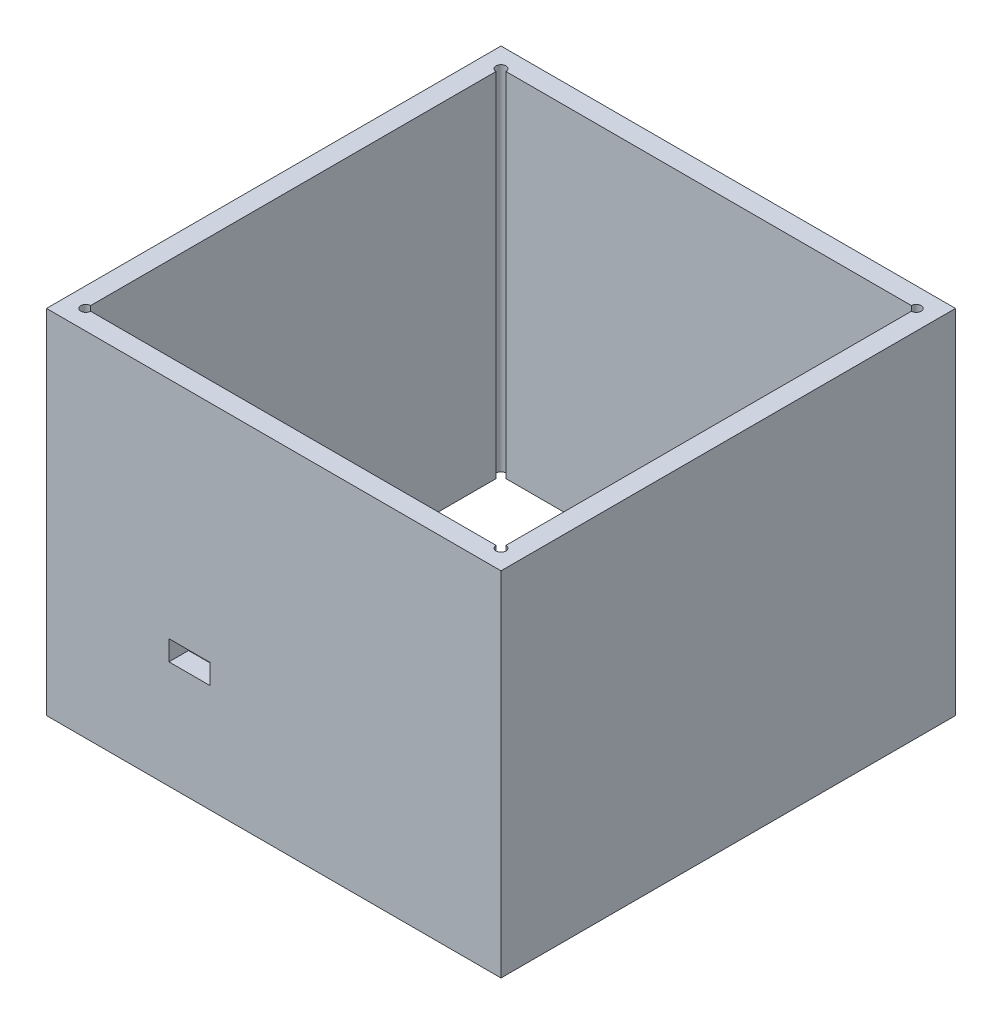
from build123d import *

# Parameters (mm, degrees)
SKETCH2_W           = 232
SKETCH2_H           = 232
SKETCH2_W_2         = 212
SKETCH2_H_2         = 212
BOSS_EXTRUDE1_DEPTH = 180
CUT_EXTRUDE1_REACH  = 317.721
SKETCH3_W           = 21
SKETCH3_H           = 10.25
CUT_EXTRUDE2_REACH  = 317.721
SKETCH4_W           = 21
SKETCH4_H           = 10.25
CUT_EXTRUDE3_REACH  = 245.541
SKETCH5_R           = 2.5


with BuildPart() as part:
    # Sketch2 → Boss-Extrude1 (new body)
    with BuildSketch(Plane(origin=(0, 0, 0), x_dir=(1, 0, 0), z_dir=(0, 1, 0))):
        Rectangle(SKETCH2_W, SKETCH2_H)
        Rectangle(SKETCH2_W_2, SKETCH2_H_2, mode=Mode.SUBTRACT)
    extrude(amount=BOSS_EXTRUDE1_DEPTH)

    # Sketch3 → Cut-Extrude1 (cut, up to next)
    with BuildSketch(Plane.XY.offset(116), mode=Mode.PRIVATE) as cut_extrude1_sk1:
        with Locations((-43, 60.125)):
            Rectangle(SKETCH3_W, SKETCH3_H)
    cut_extrude1_tool1 = extrude(cut_extrude1_sk1.sketch, amount=-CUT_EXTRUDE1_REACH, mode=Mode.PRIVATE) & part.part
    add(cut_extrude1_tool1.solids().sort_by_distance((-43, 60.125, 116))[0], mode=Mode.SUBTRACT)

    # Sketch4 → Cut-Extrude2 (cut, up to next)
    with BuildSketch(Plane(origin=(0, 0, -116), x_dir=(-1, 0, 0), z_dir=(0, 0, -1)), mode=Mode.PRIVATE) as cut_extrude2_sk1:
        with Locations((-43, 60.125)):
            Rectangle(SKETCH4_W, SKETCH4_H)
    cut_extrude2_tool1 = extrude(cut_extrude2_sk1.sketch, amount=-CUT_EXTRUDE2_REACH, mode=Mode.PRIVATE) & part.part
    add(cut_extrude2_tool1.solids().sort_by_distance((43, 60.125, -116))[0], mode=Mode.SUBTRACT)

    # Sketch5 → Cut-Extrude3 (cut, up to next)
    with BuildSketch(Plane(origin=(0, 180, 0), x_dir=(1, 0, 0), z_dir=(0, 1, 0)), mode=Mode.PRIVATE) as cut_extrude3_sk1:
        with Locations((-106, 106)):
            Circle(SKETCH5_R)
    cut_extrude3_tool1 = extrude(cut_extrude3_sk1.sketch, amount=-CUT_EXTRUDE3_REACH, mode=Mode.PRIVATE) & part.part
    # Sketch5 → Cut-Extrude3 (cut, up to next)
    with BuildSketch(Plane(origin=(0, 180, 0), x_dir=(1, 0, 0), z_dir=(0, 1, 0)), mode=Mode.PRIVATE) as cut_extrude3_sk2:
        with Locations((106, 106)):
            Circle(SKETCH5_R)
    cut_extrude3_tool2 = extrude(cut_extrude3_sk2.sketch, amount=-CUT_EXTRUDE3_REACH, mode=Mode.PRIVATE) & part.part
    # Sketch5 → Cut-Extrude3 (cut, up to next)
    with BuildSketch(Plane(origin=(0, 180, 0), x_dir=(1, 0, 0), z_dir=(0, 1, 0)), mode=Mode.PRIVATE) as cut_extrude3_sk3:
        with Locations((106, -106)):
            Circle(SKETCH5_R)
    cut_extrude3_tool3 = extrude(cut_extrude3_sk3.sketch, amount=-CUT_EXTRUDE3_REACH, mode=Mode.PRIVATE) & part.part
    # Sketch5 → Cut-Extrude3 (cut, up to next)
    with BuildSketch(Plane(origin=(0, 180, 0), x_dir=(1, 0, 0), z_dir=(0, 1, 0)), mode=Mode.PRIVATE) as cut_extrude3_sk4:
        with Locations((-106, -106)):
            Circle(SKETCH5_R)
    cut_extrude3_tool4 = extrude(cut_extrude3_sk4.sketch, amount=-CUT_EXTRUDE3_REACH, mode=Mode.PRIVATE) & part.part
    add(cut_extrude3_tool1.solids().sort_by_distance((-106, 180, -106))[0], mode=Mode.SUBTRACT)
    add(cut_extrude3_tool2.solids().sort_by_distance((106, 180, -106))[0], mode=Mode.SUBTRACT)
    add(cut_extrude3_tool3.solids().sort_by_distance((106, 180, 106))[0], mode=Mode.SUBTRACT)
    add(cut_extrude3_tool4.solids().sort_by_distance((-106, 180, 106))[0], mode=Mode.SUBTRACT)


solid = part.part
